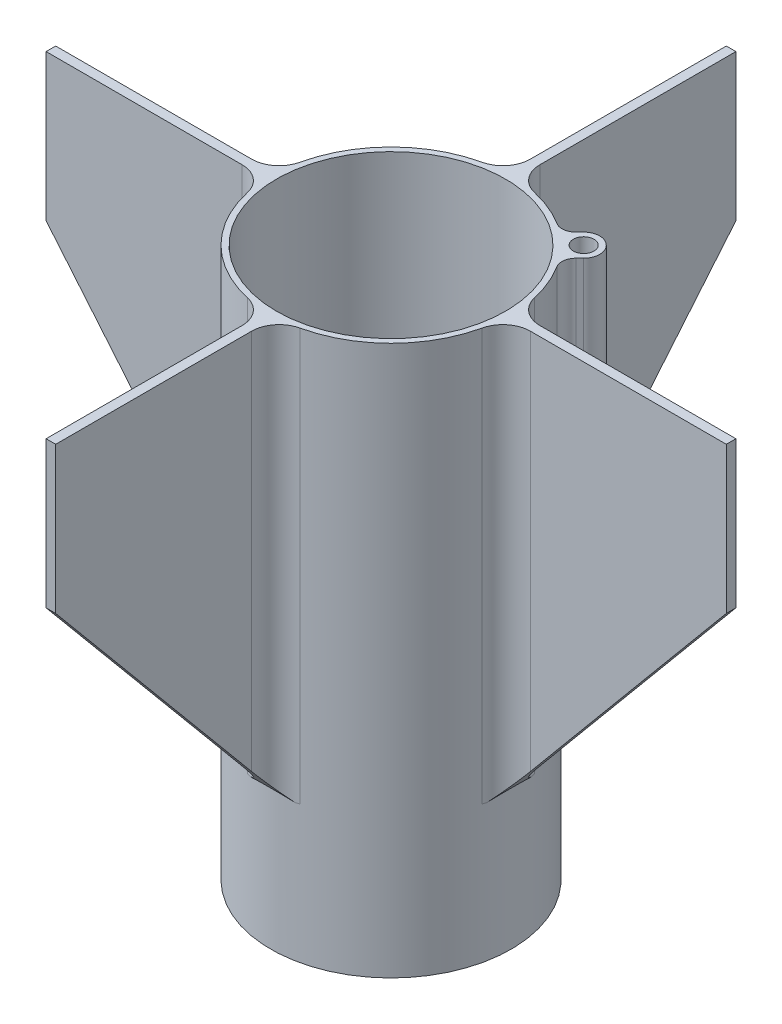
from build123d import *
from build123d.topology import SkipClean

# Parameters (mm, degrees)
SKETCH1_R             = 22.225
SKETCH1_R_2           = 9.05
BOSS_EXTRUDE1_DEPTH   = 63.5
SKETCH2_R             = 11.9
BOSS_EXTRUDE2_DEPTH   = 69.85
BOSS_EXTRUDE3_START   = -2.032
SKETCH5_R             = 22.225
SKETCH5_R_2           = 9.05
BOSS_EXTRUDE3_DEPTH   = 2.032
SKETCH6_R             = 1.5875
BOSS_EXTRUDE4_DEPTH   = 19.05
SKETCH6_2_R           = 1.5875
CUT_EXTRUDE8_DEPTH    = 19.05
BOSS_EXTRUDE5_START   = -76.2
BOSS_EXTRUDE5_DEPTH   = 76.2
CUT_EXTRUDE9_DEPTH    = 97.774416666
BOSS_EXTRUDE6_DEPTH   = 15.875
BOSS_EXTRUDE6_2_DEPTH = 15.875
BOSS_EXTRUDE7_START   = 38.1
SKETCH11_R            = 22.225
SKETCH11_R_2          = 21.175
BOSS_EXTRUDE7_DEPTH   = 38.1
CIRPATTERN2_COUNT     = 4
CIRPATTERN2_2_COUNT   = 4
SKETCH24_R            = 1.905
BOSS_EXTRUDE13_DEPTH  = 50.8
FILLET1_R             = 2.54
CUT_REVOLVE1_ANGLE    = 25.63963
CUT_EXTRUDE10_START   = -3.686202
SKETCH28_R            = 3.175
CUT_EXTRUDE10_DEPTH   = 20.1828
SKETCH30_R            = 21.175
CUT_EXTRUDE11_DEPTH   = 136.005838653


# Read off the part's stored shape, not the designer's step: Cut-Revolve1
with BuildPart() as part:
    # Sketch1 → Boss-Extrude1 (new body)
    with BuildSketch(Plane(origin=(0, 0, 0), x_dir=(1, 0, 0), z_dir=(0, 1, 0))):
        with Locations(Location((0, 0, 0), (0, 0, 270))):
            Circle(SKETCH1_R)
        with Locations(Location((0, 0, 0), (0, 0, 270))):
            Circle(SKETCH1_R_2, mode=Mode.SUBTRACT)
        with BuildLine():
            Line((0.5207, 10.077957406), (0.5207, 21.168596942))
            ThreePointArc((0.5207, 21.168596942), (14.972986092, 14.972986092), (21.168596942, 0.5207))
            Line((21.168596942, 0.5207), (10.077957406, 0.5207))
            ThreePointArc((10.077957406, 0.5207), (7.135697372, 7.135697372), (0.5207, 10.077957406))
        make_face(mode=Mode.SUBTRACT)
        with BuildLine():
            Line((-0.5207, 10.077957406), (-0.5207, 21.168596942))
            ThreePointArc((-0.5207, 21.168596942), (-14.972986092, 14.972986092), (-21.168596942, 0.5207))
            Line((-21.168596942, 0.5207), (-10.077957406, 0.5207))
            ThreePointArc((-10.077957406, 0.5207), (-7.135697372, 7.135697372), (-0.5207, 10.077957406))
        make_face(mode=Mode.SUBTRACT)
        with BuildLine():
            Line((10.077957406, -0.5207), (21.168596942, -0.5207))
            ThreePointArc((21.168596942, -0.5207), (14.972986092, -14.972986092), (0.5207, -21.168596942))
            Line((0.5207, -21.168596942), (0.5207, -10.077957406))
            ThreePointArc((0.5207, -10.077957406), (7.135697372, -7.135697372), (10.077957406, -0.5207))
        make_face(mode=Mode.SUBTRACT)
        with BuildLine():
            Line((-0.5207, -10.077957406), (-0.5207, -21.168596942))
            ThreePointArc((-0.5207, -21.168596942), (-14.972986092, -14.972986092), (-21.168596942, -0.5207))
            Line((-21.168596942, -0.5207), (-10.077957406, -0.5207))
            ThreePointArc((-10.077957406, -0.5207), (-7.135697372, -7.135697372), (-0.5207, -10.077957406))
        make_face(mode=Mode.SUBTRACT)
    extrude(amount=BOSS_EXTRUDE1_DEPTH)

    # Sketch5 → Boss-Extrude3 (add)
    with BuildSketch(Plane(origin=(0, 63.5, 0), x_dir=(1, 0, 0), z_dir=(0, 1, 0)).offset(BOSS_EXTRUDE3_START)):
        with Locations(Location((0, 0, 0), (0, 0, 270))):
            Circle(SKETCH5_R)
        with Locations(Location((0, 0, 0), (0, 0, 270))):
            Circle(SKETCH5_R_2, mode=Mode.SUBTRACT)
    extrude(amount=BOSS_EXTRUDE3_DEPTH)

    # Sketch6 → Boss-Extrude4 (add)
    # profile 1 of 2: a face of its own
    with BuildSketch(Plane(origin=(0, 63.5, 0), x_dir=(1, 0, 0), z_dir=(0, 1, 0))):
        with BuildLine():
            Line((9.784809653, 2.468573274), (9.784809653, -2.468573274))
            ThreePointArc((9.784809653, -2.468573274), (14.7904, 0), (9.784809653, 2.468573274))
        make_face()
        with Locations((11.6789, 0)):
            Circle(SKETCH6_R, mode=Mode.SUBTRACT)
    # profile 2 of 2: a face of its own
    with BuildSketch(Plane(origin=(0, 63.5, 0), x_dir=(1, 0, 0), z_dir=(0, 1, 0))):
        with BuildLine():
            Line((-9.784809653, 2.468573274), (-9.784809653, -2.468573274))
            ThreePointArc((-9.784809653, -2.468573274), (-14.7904, 0), (-9.784809653, 2.468573274))
        make_face()
        with Locations((-11.6789, 0)):
            Circle(SKETCH6_R, mode=Mode.SUBTRACT)
    extrude(amount=-BOSS_EXTRUDE4_DEPTH)

    # Sketch6<2> → Cut-Extrude8 (cut)
    with BuildSketch(Plane(origin=(0, 63.5, 0), x_dir=(1, 0, 0), z_dir=(0, 1, 0))):
        with Locations(Location((-11.6789, 0, 0), (0, 0, 270))):
            Circle(SKETCH6_2_R)
        with Locations(Location((11.6789, 0, 0), (0, 0, 270))):
            Circle(SKETCH6_2_R)
    extrude(amount=-CUT_EXTRUDE8_DEPTH, mode=Mode.SUBTRACT)

    # Sketch8 → Boss-Extrude5 (add)
    with BuildSketch(Plane(origin=(0, 63.5, 0), x_dir=(1, 0, 0), z_dir=(0, 1, 0)).offset(BOSS_EXTRUDE5_START)):
        with BuildLine():
            Line((26.644587893, -0.889), (62.865, -0.889))
            Line((62.865, -0.889), (62.865, 0.889))
            Line((62.865, 0.889), (26.644587893, 0.889))
            ThreePointArc((26.644587893, 0.889), (23.469292558, 2.003662746), (21.687455262, 4.858488372))
            ThreePointArc((21.687455262, 4.858488372), (22.225, 0), (21.687455262, -4.858488372))
            ThreePointArc((21.687455262, -4.858488372), (23.469292558, -2.003662746), (26.644587893, -0.889))
        make_face()
    boss_extrude5 = extrude(amount=BOSS_EXTRUDE5_DEPTH)

    # Sketch9 → Cut-Extrude9 (cut, symmetric)
    with BuildSketch(Plane(origin=(0, 0, -0.889), x_dir=(-1, 0, 0), z_dir=(0, 0, -1))):
        Polygon((-21.887063983, -12.7), (-62.865, 36.422254278), (-62.865, -12.7), align=None)
    cut_extrude9 = extrude(amount=CUT_EXTRUDE9_DEPTH, both=True, mode=Mode.SUBTRACT)

    # CirPattern2: Boss-Extrude5 ×4 about axis
    cirpattern2_axis = Axis((0, 0, 0), (0, 1, 0))
    for i in range(1, CIRPATTERN2_COUNT):
        add(boss_extrude5.rotate(cirpattern2_axis, i * 360 / CIRPATTERN2_COUNT))

    # CirPattern2 2: Cut-Extrude9 ×4 about axis
    cirpattern2_2_axis = Axis((0, 0, 0), (0, 1, 0))
    for i in range(1, CIRPATTERN2_2_COUNT):
        add(cut_extrude9.rotate(cirpattern2_2_axis, i * 360 / CIRPATTERN2_2_COUNT), mode=Mode.SUBTRACT)


with BuildPart() as body_2:
    # Sketch2 → Boss-Extrude2 (new body)
    with BuildSketch(Plane.XZ):
        with Locations(Location((0, 0, 0), (0, 0, 270))):
            Circle(SKETCH2_R)
    extrude(amount=-BOSS_EXTRUDE2_DEPTH)


with BuildPart() as body_3:
    # Sketch10 → Boss-Extrude6 (new body)
    with BuildSketch(Plane.XZ):
        with BuildLine():
            Line((6.405198203, 7.798063217), (6.405198203, -7.798063217))
            ThreePointArc((6.405198203, -7.798063217), (10.0914, 0), (6.405198203, 7.798063217))
        make_face()
    extrude(amount=BOSS_EXTRUDE6_DEPTH)


with BuildPart() as body_4:
    # Sketch10 → Boss-Extrude6 2 (new body)
    with BuildSketch(Plane.XZ):
        with BuildLine():
            Line((-6.405198203, 7.798063217), (-6.405198203, -7.798063217))
            ThreePointArc((-6.405198203, -7.798063217), (-10.0914, 0), (-6.405198203, 7.798063217))
        make_face()
    extrude(amount=BOSS_EXTRUDE6_2_DEPTH)

    # Combine3: union body 3, part
    add(body_3.part)
    add(part.part)


with BuildPart() as body_5:
    # Sketch11 → Boss-Extrude7 (new body)
    with BuildSketch(Plane.XZ.offset(BOSS_EXTRUDE7_START)):
        with Locations(Location((0, 0, 0), (0, 0, 90))):
            Circle(SKETCH11_R)
        with Locations(Location((0, 0, 0), (0, 0, 90))):
            Circle(SKETCH11_R_2, mode=Mode.SUBTRACT)
    extrude(amount=-BOSS_EXTRUDE7_DEPTH)

    # Combine4: union body 4
    add(body_4.part)

    # Sketch24 → Boss-Extrude13 (add)
    with SkipClean():  # the faces are left unmerged after this step: merging them gives an invalid solid
        with BuildSketch(Plane(origin=(0, 63.5, 0), x_dir=(1, 0, 0), z_dir=(0, 1, 0))):
            with BuildLine():
                Line((15.715448212, 19.894449289), (13.48641998, 17.665421057))
                ThreePointArc((13.48641998, 17.665421057), (15.715448212, 15.715448212), (17.665421057, 13.48641998))
                Line((17.665421057, 13.48641998), (19.894449289, 15.715448212))
                ThreePointArc((19.894449289, 15.715448212), (19.894449289, 19.894449289), (15.715448212, 19.894449289))
            make_face()
            with Locations(Location((17.80494875, 17.80494875, 0), (0, 0, 270))):
                Circle(SKETCH24_R, mode=Mode.SUBTRACT)
        extrude(amount=-BOSS_EXTRUDE13_DEPTH)

    # Fillet1
    # the kernel refuses this fillet: 2.54 mm, written as the material it adds along each edge
    with BuildSketch(Plane(origin=(17.665421057, 63.5, -13.48641998), x_dir=(0.5702807097884103, 0, 0.8214498840728065), z_dir=(0, -1, 0))) as fillet1_piece_1:
        with BuildLine():
            CenterArc((2.123100743, -2.537406084), FILLET1_R, 92.589617746, 77.180185074)
            Line((-0.376518694, -2.086293381), (0, 0))
            ThreePointArc((0, 0), (1.00416927, -0.022696762), (2.00833854, 0))
        make_face()
    extrude(amount=50.8)
    with BuildSketch(Plane(origin=(13.48641998, 63.5, -17.665421057), x_dir=(-0.8214498840728011, 0, -0.5702807097884178), z_dir=(0, -1, 0))) as fillet1_piece_2:
        with BuildLine():
            CenterArc((2.123100743, 2.537406084), FILLET1_R, 190.23019718, 77.180185074)
            Line((-0.376518694, 2.086293381), (0, 0))
            ThreePointArc((0, 0), (1.00416927, 0.022696762), (2.00833854, 0))
        make_face()
    extrude(amount=50.8)

    # Cut-Revolve1 outline → Cut-Revolve1 (revolve, cut)
    with BuildSketch(Plane(origin=(0, 0, 0), x_dir=(0.8463774031608068, 0, -0.5325836004035134), z_dir=(0.5325836004035134, 0, 0.8463774031608068))):
        Polygon((28.135, 22.936420272), (22.224995946, 12.699992978), (28.135, 12.7), align=None)
    revolve(axis=Axis((0, 0, 0), (0, 1, 0)), revolution_arc=CUT_REVOLVE1_ANGLE, mode=Mode.SUBTRACT)

    # Sketch28 → Cut-Extrude10 (cut)
    with BuildSketch(Plane(origin=(-6.405198203, 0, 0), x_dir=(0, 0, -1), z_dir=(1, 0, 0)).offset(CUT_EXTRUDE10_START)):
        with BuildLine():
            ThreePointArc((0, -15.875), (-4.312339676, -14.90751986), (-7.798063217, -12.19053206))
            Line((-7.798063217, -12.19053206), (-7.798063217, -15.875))
            Line((-7.798063217, -15.875), (0, -15.875))
        make_face()
        with BuildLine():
            ThreePointArc((7.798063217, -12.19053206), (4.312339676, -14.90751986), (0, -15.875))
            Line((0, -15.875), (7.798063217, -15.875))
            Line((7.798063217, -15.875), (7.798063217, -12.19053206))
        make_face()
        with Locations((0, -5.780585399)):
            Circle(SKETCH28_R)
    extrude(amount=CUT_EXTRUDE10_DEPTH, mode=Mode.SUBTRACT)

    # Sketch30 → Cut-Extrude11 (cut, through all)
    with BuildSketch(Plane.XZ.offset(38.1)):
        with Locations(Location((0, 0, 0), (0, 0, 90))):
            Circle(SKETCH30_R)
    extrude(amount=-CUT_EXTRUDE11_DEPTH, mode=Mode.SUBTRACT)


solid = body_5.part
